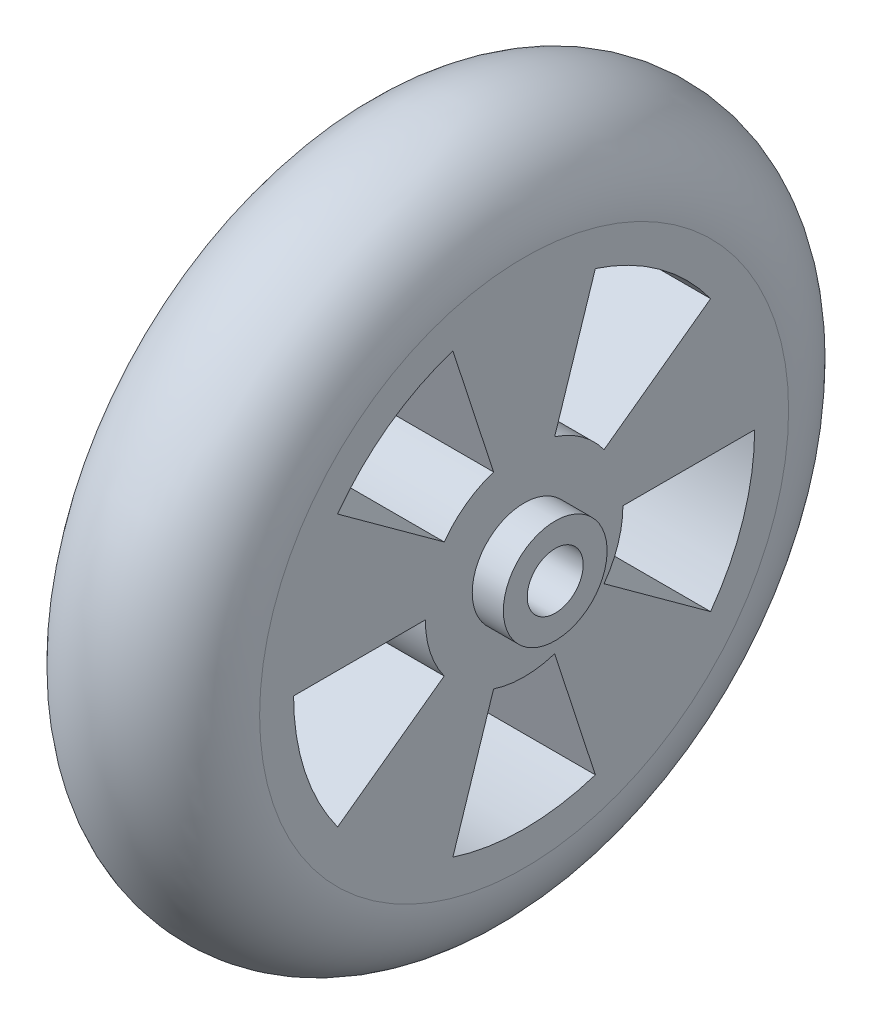
from build123d import *

# Parameters (mm, degrees)
SKETCH2_R          = 2.7
CUT_EXTRUDE1_DEPTH = 53.076866396
CUT_EXTRUDE2_DEPTH = 53.076866396


with BuildPart() as part:
    # Sketch1 → Revolve1 (revolve)
    with BuildSketch(Plane.XY):
        with BuildLine():
            Line((0, 25.5), (0, 0))
            Line((0, 0), (20, 0))
            Line((20, 0), (20, 5))
            Line((20, 5), (17, 5))
            Line((17, 5), (17, 25.5))
            ThreePointArc((17, 25.5), (8.5, 34), (0, 25.5))
        make_face()
    revolve(axis=Axis((0, 0, 0), (1, 0, 0)))

    # Sketch2 → Cut-Extrude1 (cut, through all)
    with BuildSketch(Plane(origin=(0, 0, 0), x_dir=(0, 0, -1), z_dir=(1, 0, 0))):
        Circle(SKETCH2_R)
    extrude(amount=CUT_EXTRUDE1_DEPTH, mode=Mode.SUBTRACT)

    # Sketch3 → Cut-Extrude2 (cut, through all)
    with BuildSketch(Plane(origin=(0, 0, 0), x_dir=(0, 0, -1), z_dir=(1, 0, 0))):
        with BuildLine():
            Line((6.8679027, 21.137231075), (2.943386871, 9.058813318))
            ThreePointArc((2.943386871, 9.058813318), (5.598654528, 7.705886871), (7.705886871, 5.598654528))
            Line((7.705886871, 5.598654528), (17.9804027, 13.063527232))
            ThreePointArc((17.9804027, 13.063527232), (13.063527232, 17.9804027), (6.8679027, 21.137231075))
        make_face()
        with BuildLine():
            Line((22.225, 0), (9.525, 0))
            ThreePointArc((9.525, 0), (9.058813318, -2.943386871), (7.705886871, -5.598654528))
            Line((7.705886871, -5.598654528), (17.9804027, -13.063527232))
            ThreePointArc((17.9804027, -13.063527232), (21.137231075, -6.8679027), (22.225, 0))
        make_face()
        with BuildLine():
            Line((6.8679027, -21.137231075), (2.943386871, -9.058813318))
            ThreePointArc((2.943386871, -9.058813318), (0, -9.525), (-2.943386871, -9.058813318))
            Line((-2.943386871, -9.058813318), (-6.8679027, -21.137231075))
            ThreePointArc((-6.8679027, -21.137231075), (0, -22.225), (6.8679027, -21.137231075))
        make_face()
        with BuildLine():
            Line((-17.9804027, -13.063527232), (-7.705886871, -5.598654528))
            ThreePointArc((-7.705886871, -5.598654528), (-9.058813318, -2.943386871), (-9.525, 0))
            Line((-9.525, 0), (-22.225, 0))
            ThreePointArc((-22.225, 0), (-21.137231075, -6.8679027), (-17.9804027, -13.063527232))
        make_face()
        with BuildLine():
            Line((-17.9804027, 13.063527232), (-7.705886871, 5.598654528))
            ThreePointArc((-7.705886871, 5.598654528), (-5.598654528, 7.705886871), (-2.943386871, 9.058813318))
            Line((-2.943386871, 9.058813318), (-6.8679027, 21.137231075))
            ThreePointArc((-6.8679027, 21.137231075), (-13.063527232, 17.9804027), (-17.9804027, 13.063527232))
        make_face()
    extrude(amount=CUT_EXTRUDE2_DEPTH, mode=Mode.SUBTRACT)


solid = part.part
